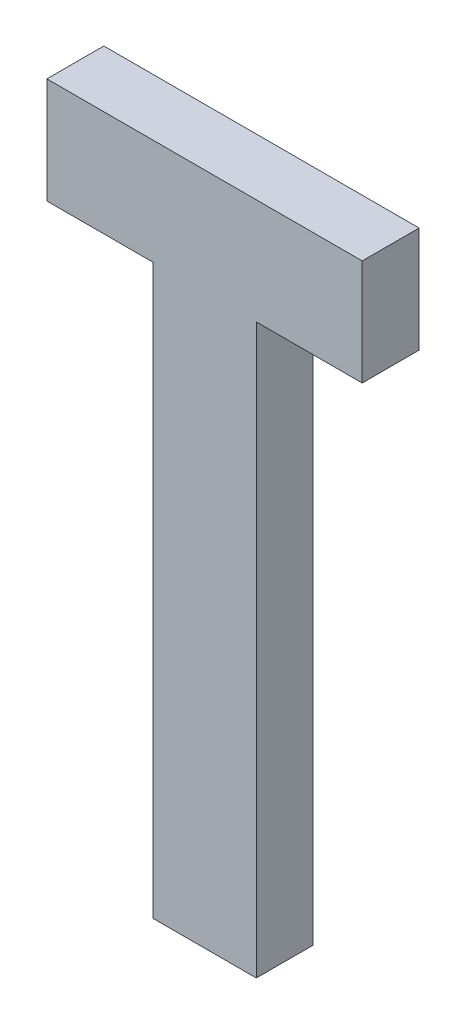
from build123d import *

# Parameters (mm, degrees)
BOSS_EXTRUDE2_DEPTH = 5.5


with BuildPart() as part:
    # Sketch2 → Boss-Extrude2 (new body)
    with BuildSketch(Plane.XY):
        Polygon((5, 24.891407059), (15.229503171, 24.891407059), (15.229503171, 35.108592941), (-15.229503171, 35.108592941), (-15.229503171, 24.891407059), (-5, 24.891407059), (-5, -30), (5, -30), align=None)
    extrude(amount=BOSS_EXTRUDE2_DEPTH)


solid = part.part
